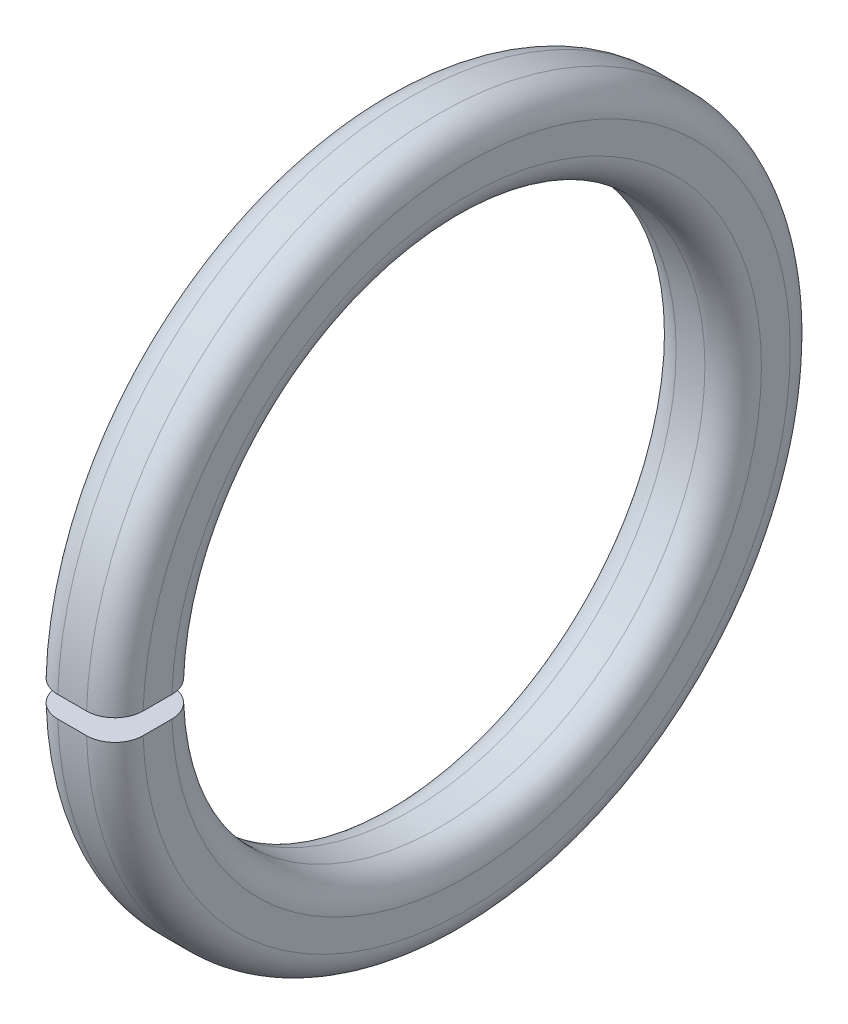
from build123d import *

# Parameters (mm, degrees)
SKETCH2_W = 2
SKETCH2_H = 33.66
GAP_DEPTH = 48.349762546


with BuildPart() as part:
    # Sketch1 → Base-Revolve (revolve)
    with BuildSketch(Plane.XY):
        with BuildLine():
            Line((0, 27.65), (0, 30.35))
            ThreePointArc((0, 30.35), (-0.77616703, 32.22383297), (-2.65, 33))
            Line((-2.65, 33), (-5.35, 33))
            ThreePointArc((-5.35, 33), (-7.22383297, 32.22383297), (-8, 30.35))
            Line((-8, 30.35), (-8, 27.65))
            ThreePointArc((-8, 27.65), (-7.22383297, 25.77616703), (-5.35, 25))
            Line((-5.35, 25), (-2.65, 25))
            ThreePointArc((-2.65, 25), (-0.77616703, 25.77616703), (0, 27.65))
        make_face()
    revolve(axis=Axis((-34.925, 0, 0), (1, 0, 0)))

    # Sketch2 → Gap (cut, through all)
    with BuildSketch(Plane(origin=(0, 0, 0), x_dir=(0, -1, 0), z_dir=(-1, 0, 0))):
        with Locations((0, 16.83)):
            Rectangle(SKETCH2_W, SKETCH2_H)
    extrude(amount=GAP_DEPTH, mode=Mode.SUBTRACT)


solid = part.part
